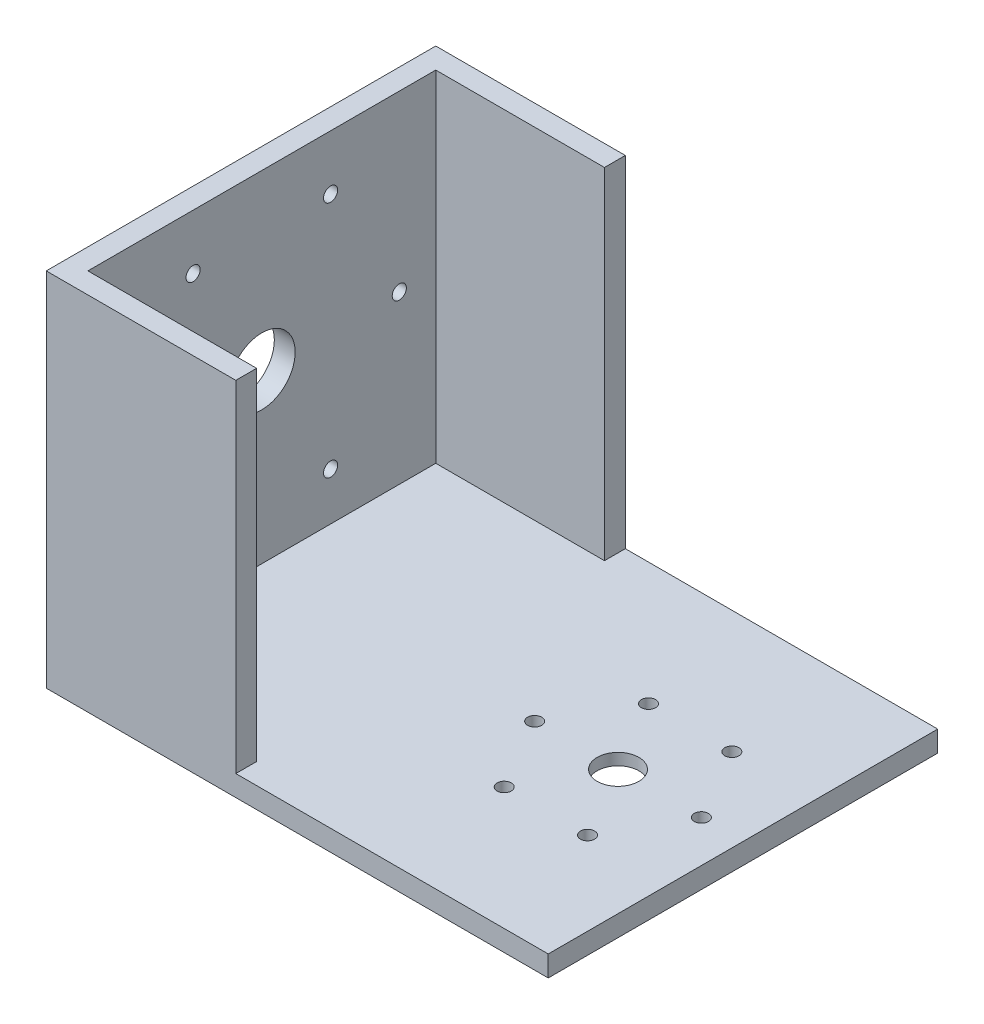
from build123d import *

# Parameters (mm, degrees)
SK_OUTPUT_PLATE_W        = 120.5
SK_OUTPUT_PLATE_H        = 93.5
SK_OUTPUT_PLATE_R        = 1.7
SK_OUTPUT_PLATE_R_2      = 5
OUTPUT_PLATE_DEPTH       = 5
SK_PITCH_PILOT_RECESS_R  = 15.15
PITCH_PILOT_RECESS_DEPTH = 2.2
SK_REAR_PLATE_W          = 93.5
SK_REAR_PLATE_H          = 86.75
SK_REAR_PLATE_R          = 8
SK_REAR_PLATE_R_2        = 1.7
REAR_PLATE_DEPTH         = 5
SK_TOP_PLATE_W           = 45.5
SK_TOP_PLATE_H           = 86.75
TOP_PLATE_DEPTH          = 5
SK_BOTTOM_PLATE_W        = 45.5
SK_BOTTOM_PLATE_H        = 86.75
BOTTOM_PLATE_DEPTH       = 5


with BuildPart() as part:
    # SK_Output_Plate → Output_Plate (new body)
    with BuildSketch(Plane(origin=(0, 0, 0), x_dir=(1, 0, 0), z_dir=(0, 1, 0))):
        with Locations((-30.25, 0)):
            Rectangle(SK_OUTPUT_PLATE_W, SK_OUTPUT_PLATE_H)
        with Locations((20, 0)):
            Circle(SK_OUTPUT_PLATE_R, mode=Mode.SUBTRACT)
        with Locations((10, 17.320508076)):
            Circle(SK_OUTPUT_PLATE_R, mode=Mode.SUBTRACT)
        with Locations((-10, 17.320508076)):
            Circle(SK_OUTPUT_PLATE_R, mode=Mode.SUBTRACT)
        with Locations((-20, 0)):
            Circle(SK_OUTPUT_PLATE_R, mode=Mode.SUBTRACT)
        with Locations((-10, -17.320508076)):
            Circle(SK_OUTPUT_PLATE_R, mode=Mode.SUBTRACT)
        with Locations((10, -17.320508076)):
            Circle(SK_OUTPUT_PLATE_R, mode=Mode.SUBTRACT)
        Circle(SK_OUTPUT_PLATE_R_2, mode=Mode.SUBTRACT)
    extrude(amount=OUTPUT_PLATE_DEPTH)

    # SK_Pitch_Pilot_Recess → Pitch_Pilot_Recess (cut)
    with BuildSketch(Plane(origin=(0, 0, 0), x_dir=(1, 0, 0), z_dir=(0, 1, 0))):
        Circle(SK_PITCH_PILOT_RECESS_R)
    extrude(amount=PITCH_PILOT_RECESS_DEPTH, mode=Mode.SUBTRACT)

    # SK_Rear_Plate → Rear_Plate (add)
    with BuildSketch(Plane(origin=(-90.5, 0, 0), x_dir=(0, 0, -1), z_dir=(1, 0, 0))):
        with Locations((0, 43.375)):
            Rectangle(SK_REAR_PLATE_W, SK_REAR_PLATE_H)
        with Locations((0, 45)):
            Circle(SK_REAR_PLATE_R, mode=Mode.SUBTRACT)
        with Locations((33, 45)):
            Circle(SK_REAR_PLATE_R_2, mode=Mode.SUBTRACT)
        with Locations((16.5, 73.578838325)):
            Circle(SK_REAR_PLATE_R_2, mode=Mode.SUBTRACT)
        with Locations((-16.5, 73.578838325)):
            Circle(SK_REAR_PLATE_R_2, mode=Mode.SUBTRACT)
        with Locations((-33, 45)):
            Circle(SK_REAR_PLATE_R_2, mode=Mode.SUBTRACT)
        with Locations((-16.5, 16.421161675)):
            Circle(SK_REAR_PLATE_R_2, mode=Mode.SUBTRACT)
        with Locations((16.5, 16.421161675)):
            Circle(SK_REAR_PLATE_R_2, mode=Mode.SUBTRACT)
    extrude(amount=REAR_PLATE_DEPTH)

    # SK_Top_Plate → Top_Plate (add)
    with BuildSketch(Plane.XY.offset(41.75)):
        with Locations((-67.75, 43.375)):
            Rectangle(SK_TOP_PLATE_W, SK_TOP_PLATE_H)
    extrude(amount=TOP_PLATE_DEPTH)

    # SK_Bottom_Plate → Bottom_Plate (add)
    with BuildSketch(Plane.XY.offset(-46.75)):
        with Locations((-67.75, 43.375)):
            Rectangle(SK_BOTTOM_PLATE_W, SK_BOTTOM_PLATE_H)
    extrude(amount=BOTTOM_PLATE_DEPTH)


solid = part.part
